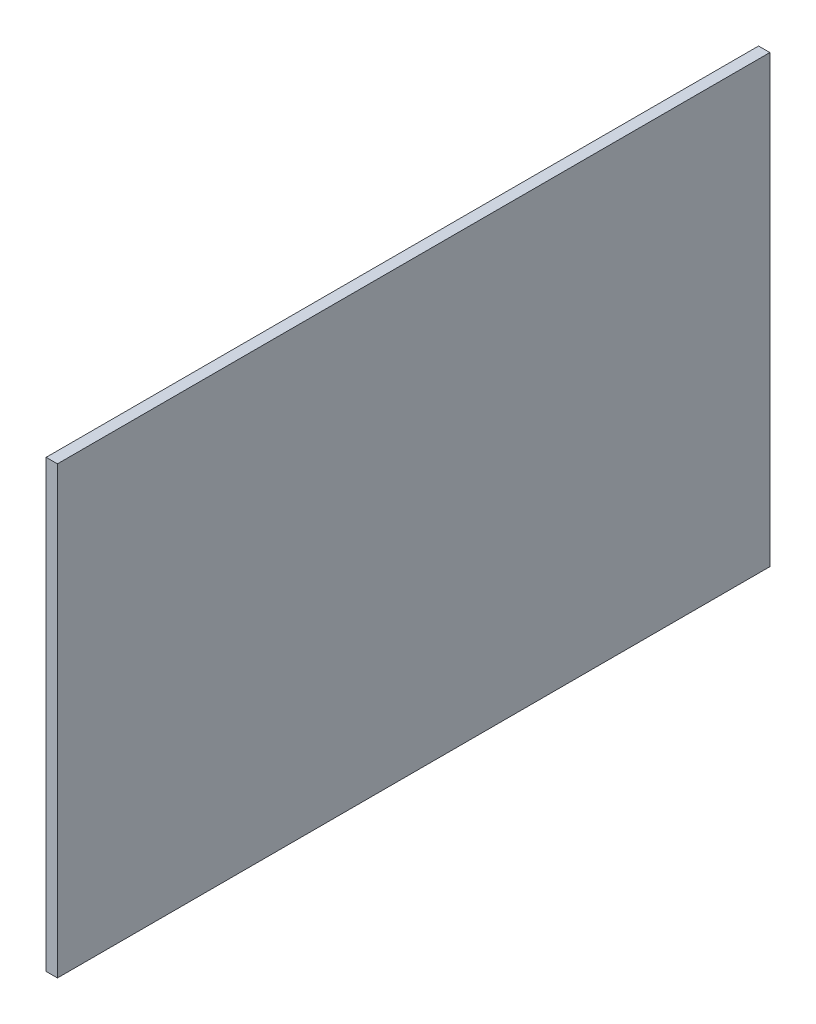
from build123d import *

# Parameters (mm, degrees)
SKETCH1_W           = 159.9946
SKETCH1_H           = 99.9998
BOSS_EXTRUDE1_DEPTH = 1.27


with BuildPart() as part:
    # Sketch1 → Boss-Extrude1 (new, symmetric)
    with BuildSketch(Plane(origin=(0, 0, 0), x_dir=(0, 0, -1), z_dir=(1, 0, 0))):
        Rectangle(SKETCH1_W, SKETCH1_H)
    extrude(amount=BOSS_EXTRUDE1_DEPTH, both=True)


solid = part.part
